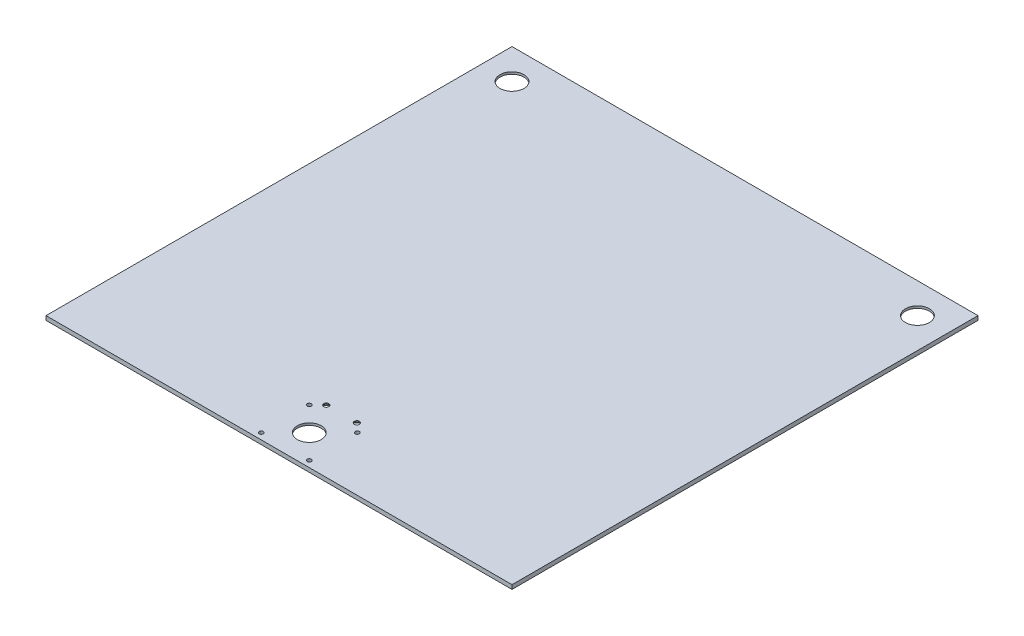
from build123d import *

# Parameters (mm, degrees)
SKETCH1_W                                           = 457.2
SKETCH1_H                                           = 457.2
BOSS_EXTRUDE1_DEPTH                                 = 4.064
SKETCH2_R                                           = 19.177
CUT_EXTRUDE1_DEPTH                                  = 1.905
CUT_EXTRUDE2_REACH                                  = 325.296
SKETCH3_R                                           = 11.7475
F_10_32_TAPPED_HOLE1_D                              = 4.0386
F_10_32_TAPPED_HOLE2_D                              = 4.0386
CBORE_FOR_10_BINDING_HEAD_MACHINE_SCREW_D           = 5.1054
CBORE_FOR_10_BINDING_HEAD_MACHINE_SCREW_CBORE_D     = 11.1125
CBORE_FOR_10_BINDING_HEAD_MACHINE_SCREW_CBORE_DEPTH = 3.1242


with BuildPart() as part:
    # Sketch1 → Boss-Extrude1 (new body)
    with BuildSketch(Plane(origin=(0, 0, 0), x_dir=(1, 0, 0), z_dir=(0, 1, 0))):
        Rectangle(SKETCH1_W, SKETCH1_H)
    extrude(amount=BOSS_EXTRUDE1_DEPTH)

    # Sketch2 → Cut-Extrude1 (cut)
    with BuildSketch(Plane.XZ):
        with Locations((0, 198.882)):
            Circle(SKETCH2_R)
        with Locations((-198.882, -198.882)):
            Circle(SKETCH2_R)
        with Locations((198.882, -198.882)):
            Circle(SKETCH2_R)
    extrude(amount=-CUT_EXTRUDE1_DEPTH, mode=Mode.SUBTRACT)

    # Sketch3 → Cut-Extrude2 (cut, up to next)
    with BuildSketch(Plane.XZ.offset(-1.905), mode=Mode.PRIVATE) as cut_extrude2_sk1:
        with Locations((0, 198.882)):
            Circle(SKETCH3_R)
    cut_extrude2_tool1 = extrude(cut_extrude2_sk1.sketch, amount=-CUT_EXTRUDE2_REACH, mode=Mode.PRIVATE) & part.part
    # Sketch3 → Cut-Extrude2 (cut, up to next)
    with BuildSketch(Plane.XZ.offset(-1.905), mode=Mode.PRIVATE) as cut_extrude2_sk2:
        with Locations((-198.882, -198.882)):
            Circle(SKETCH3_R)
    cut_extrude2_tool2 = extrude(cut_extrude2_sk2.sketch, amount=-CUT_EXTRUDE2_REACH, mode=Mode.PRIVATE) & part.part
    # Sketch3 → Cut-Extrude2 (cut, up to next)
    with BuildSketch(Plane.XZ.offset(-1.905), mode=Mode.PRIVATE) as cut_extrude2_sk3:
        with Locations((198.882, -198.882)):
            Circle(SKETCH3_R)
    cut_extrude2_tool3 = extrude(cut_extrude2_sk3.sketch, amount=-CUT_EXTRUDE2_REACH, mode=Mode.PRIVATE) & part.part
    add(cut_extrude2_tool1.solids().sort_by_distance((0, 1.905, 198.882))[0], mode=Mode.SUBTRACT)
    add(cut_extrude2_tool2.solids().sort_by_distance((-198.882, 1.905, -198.882))[0], mode=Mode.SUBTRACT)
    add(cut_extrude2_tool3.solids().sort_by_distance((198.882, 1.905, -198.882))[0], mode=Mode.SUBTRACT)

    # #10-32 Tapped Hole1 (through all)
    with Locations(Plane(origin=(0, 0, 0), x_dir=(-0.9999999805352008, 0, 0.00019730584980051711), z_dir=(0, -1, 0))):
        with Locations((23.617063566, -222.450516863), (-23.529280152, -222.459819113)):
            Hole(F_10_32_TAPPED_HOLE1_D / 2)

    # #10-32 Tapped Hole2 (through all)
    with Locations(Plane(origin=(0, 0, 0), x_dir=(-0.9999999805352008, 0, 0.00019730584980051711), z_dir=(0, -1, 0))):
        with Locations((23.607761316, -175.304173145), (-23.538582402, -175.313475395)):
            Hole(F_10_32_TAPPED_HOLE2_D / 2)

    # CBORE for #10 Binding Head Machine Screw1 (through all)
    with Locations(Plane.XZ):
        with Locations((-15, 167.174500066), (15, 167.174500066)):
            CounterBoreHole(CBORE_FOR_10_BINDING_HEAD_MACHINE_SCREW_D / 2, CBORE_FOR_10_BINDING_HEAD_MACHINE_SCREW_CBORE_D / 2, CBORE_FOR_10_BINDING_HEAD_MACHINE_SCREW_CBORE_DEPTH)


solid = part.part
